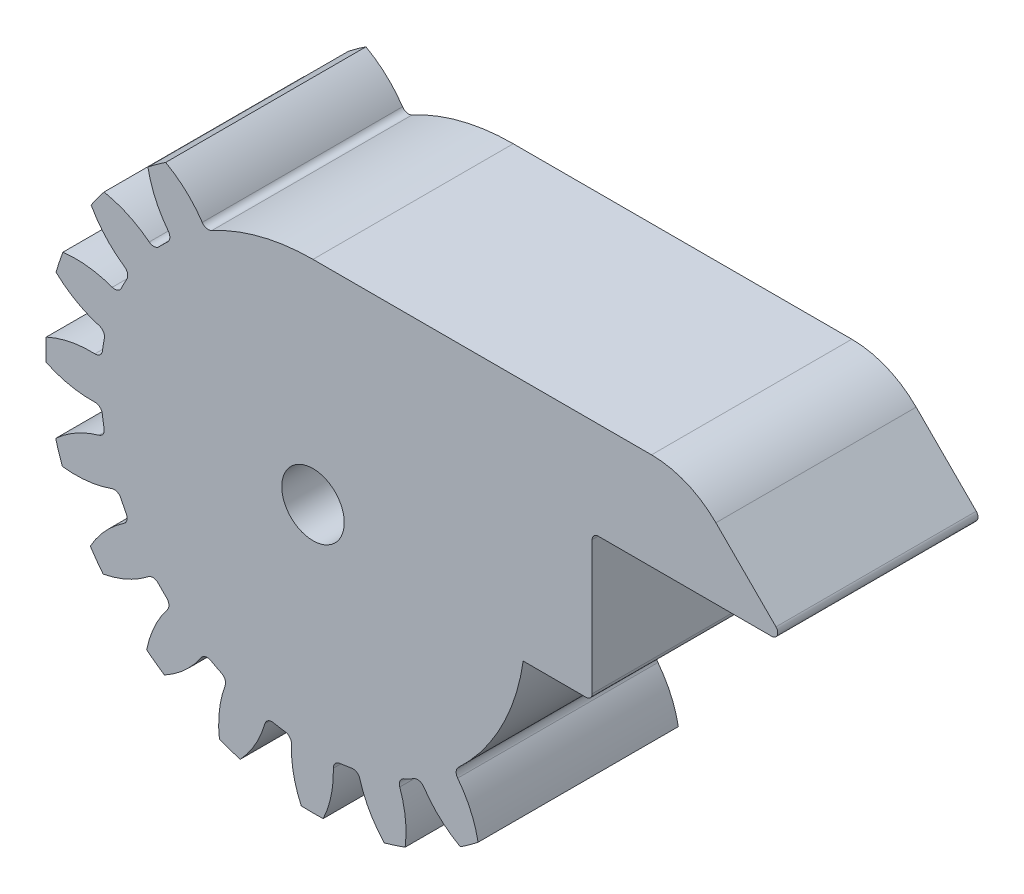
from build123d import *
from build123d.topology import SkipClean

# Parameters (mm, degrees)
SKBASE_R                                = 22
BASE_DEPTH                              = 8.25
TOOTHPROFILE_DEPTH                      = 33.187924754
FILLETTOOTHPROFILE_R                    = 0.6
CIRPATTERNTEETH_COUNT                   = 20
FILLETTOOTHPROFILE_OF_CIRPATTERNTEETH_R = 0.6
SKCHAVETA_R                             = 2.575
CHAVETA_DEPTH                           = 36.032658713
BODY_MOVE_COPY1_ANGLE                   = 8.84
CUT_EXTRUDE1_START                      = -16.5
CUT_EXTRUDE1_DEPTH                      = 16.5
BOSS_EXTRUDE1_START                     = -16.5
BOSS_EXTRUDE1_DEPTH                     = 16.5
SKETCH10_R                              = 5
SKETCH10_R_2                            = 2.575
BOSS_EXTRUDE2_DEPTH                     = 1.65
FILLET1_R                               = 0.5
FILLET2_R                               = 7.5


with BuildPart() as part:
    # skBase → Base (new, symmetric)
    with BuildSketch(Plane.XY):
        Circle(SKBASE_R)
    extrude(amount=BASE_DEPTH, both=True)

    # skToothProfile → ToothProfile (cut, symmetric)
    with BuildSketch(Plane.XY):
        with BuildLine():
            ThreePointArc((-1.056260379, 17.468094172), (-1.711312383, 20.303280592), (-3.25795804, 22.768085326))
            ThreePointArc((-3.25795804, 22.768085326), (0, 23), (3.25795804, 22.768085326))
            ThreePointArc((3.25795804, 22.768085326), (1.711312383, 20.303280592), (1.056260379, 17.468094172))
            ThreePointArc((1.056260379, 17.468094172), (0, 17.5), (-1.056260379, 17.468094172))
        make_face()
    toothprofile = extrude(amount=TOOTHPROFILE_DEPTH, both=True, mode=Mode.SUBTRACT)

    # FilletToothProfile
    fillettoothprofile_edges = [part.edges().sort_by_distance(p)[0] for p in [
        (1.056260379, 17.468094172, 0),
        (-1.056260379, 17.468094172, 0),
    ]]
    fillet(fillettoothprofile_edges, radius=FILLETTOOTHPROFILE_R)

    # CirPatternTeeth: ToothProfile ×20 about axis
    cirpatternteeth_axis = Axis((0, 0, 8.25), (0, 0, 1))
    for i in range(1, CIRPATTERNTEETH_COUNT):
        add(toothprofile.rotate(cirpatternteeth_axis, i * 360 / CIRPATTERNTEETH_COUNT), mode=Mode.SUBTRACT)

    # FilletToothProfile of CirPatternTeeth
    fillettoothprofile_of_cirpatternteeth_edges = [part.edges().sort_by_distance(p)[0] for p in [
        (-4.393374642, 16.939547198, 0),
        (-6.402501275, 16.286742382, 0),
        (-9.412955543, 14.752839318, 0),
        (-11.122020738, 13.511130771, 0),
        (-13.511130771, 11.122020738, 0),
        (-14.752839318, 9.412955543, 0),
        (-16.286742382, 6.402501275, 0),
        (-16.939547198, 4.393374642, 0),
        (-17.468094172, 1.056260379, 0),
        (-17.468094172, -1.056260379, 0),
        (-16.939547198, -4.393374642, 0),
        (-16.286742382, -6.402501275, 0),
        (-14.752839318, -9.412955543, 0),
        (-13.511130771, -11.122020738, 0),
        (-11.122020738, -13.511130771, 0),
        (-9.412955543, -14.752839318, 0),
        (-6.402501275, -16.286742382, 0),
        (-4.393374642, -16.939547198, 0),
        (-1.056260379, -17.468094172, 0),
        (1.056260379, -17.468094172, 0),
        (4.393374642, -16.939547198, 0),
        (6.402501275, -16.286742382, 0),
        (9.412955543, -14.752839318, 0),
        (11.122020738, -13.511130771, 0),
        (13.511130771, -11.122020738, 0),
        (14.752839318, -9.412955543, 0),
        (16.286742382, -6.402501275, 0),
        (16.939547198, -4.393374642, 0),
        (17.468094172, -1.056260379, 0),
        (17.468094172, 1.056260379, 0),
        (16.939547198, 4.393374642, 0),
        (16.286742382, 6.402501275, 0),
        (14.752839318, 9.412955543, 0),
        (13.511130771, 11.122020738, 0),
        (11.122020738, 13.511130771, 0),
        (9.412955543, 14.752839318, 0),
        (6.402501275, 16.286742382, 0),
        (4.393374642, 16.939547198, 0),
    ]]
    fillet(fillettoothprofile_of_cirpatternteeth_edges, radius=FILLETTOOTHPROFILE_OF_CIRPATTERNTEETH_R)

    # skChaveta → Chaveta (cut, through all)
    with BuildSketch(Plane.XY.offset(8.25)):
        Circle(SKCHAVETA_R)
    extrude(amount=-CHAVETA_DEPTH, mode=Mode.SUBTRACT)


with BuildPart() as part_1:
    # Body-Move/Copy1: moved
    add(part.part.rotate(Axis((0, 0, 0), (0, 0, 1)), BODY_MOVE_COPY1_ANGLE))

    # Sketch7 → Cut-Extrude1 (cut)
    with BuildSketch(Plane(origin=(0, 0, -8.25), x_dir=(-1, 0, 0), z_dir=(0, 0, -1)).offset(CUT_EXTRUDE1_START)):
        with BuildLine():
            ThreePointArc((3.177021559, 17.20919911), (5.361298987, 16.65852554), (7.456744124, 15.831833977))
            ThreePointArc((7.456744124, 15.831833977), (7.158104529, 16.144961281), (7.147753456, 16.577543263))
            ThreePointArc((7.147753456, 16.577543263), (7.612057292, 18.586093838), (7.594681004, 20.647537878))
            ThreePointArc((7.594681004, 20.647537878), (6.739918727, 20.942146393), (5.873773607, 21.201386361))
            ThreePointArc((5.873773607, 21.201386361), (4.657305951, 19.537036665), (3.862951402, 17.634708009))
            ThreePointArc((3.862951402, 17.634708009), (3.602236584, 17.289364557), (3.177021559, 17.20919911))
        make_face()
        with BuildLine():
            ThreePointArc((-2.296407928, 17.348674607), (-0.048869156, 17.499931766), (2.199479339, 17.361229526))
            ThreePointArc((2.199479339, 17.361229526), (1.818694547, 17.566746578), (1.675174908, 17.974957834))
            ThreePointArc((1.675174908, 17.974957834), (1.496077835, 20.028680723), (0.842530762, 21.983860942))
            ThreePointArc((0.842530762, 21.983860942), (-0.06143551, 21.99991422), (-0.965298025, 21.978812518))
            ThreePointArc((-0.965298025, 21.978812518), (-1.607915176, 20.020012717), (-1.775539362, 17.965321597))
            ThreePointArc((-1.775539362, 17.965321597), (-1.916776894, 17.556315147), (-2.296407928, 17.348674607))
        make_face()
        with BuildLine():
            ThreePointArc((-7.545049008, 15.789940958), (-5.454253645, 16.628322741), (-3.273085809, 17.191186966))
            ThreePointArc((-3.273085809, 17.191186966), (-3.698741928, 17.268976326), (-3.961381432, 17.612858293))
            ThreePointArc((-3.961381432, 17.612858293), (-4.766348144, 19.51072079), (-5.992092262, 21.168250526))
            ThreePointArc((-5.992092262, 21.168250526), (-6.856776011, 20.90417716), (-7.709879561, 20.604799372))
            ThreePointArc((-7.709879561, 20.604799372), (-7.715742363, 18.543290436), (-7.240227963, 16.537364335))
            ThreePointArc((-7.240227963, 16.537364335), (-7.248162894, 16.104731288), (-7.545049008, 15.789940958))
        make_face()
        with BuildLine():
            ThreePointArc((-12.055128121, 12.685577874), (-10.325737785, 14.12901763), (-8.425258513, 15.338351247))
            ThreePointArc((-8.425258513, 15.338351247), (-8.854119773, 15.280798351), (-9.210170156, 15.526689467))
            ThreePointArc((-9.210170156, 15.526689467), (-10.562210758, 17.082915568), (-12.240167545, 18.28054426))
            ThreePointArc((-12.240167545, 18.28054426), (-12.980927502, 17.762193592), (-13.699764368, 17.2138449))
            ThreePointArc((-13.699764368, 17.2138449), (-13.068298928, 15.251421688), (-11.996192606, 13.490614629))
            ThreePointArc((-11.996192606, 13.490614629), (-11.870048209, 13.076704123), (-12.055128121, 12.685577874))
        make_face()
        with BuildLine():
            ThreePointArc((-15.385167301, 8.339462041), (-14.186466768, 10.246665831), (-12.752708211, 11.98409084))
            ThreePointArc((-12.752708211, 11.98409084), (-13.142794684, 11.796829366), (-13.557403255, 11.920660095))
            ThreePointArc((-13.557403255, 11.920660095), (-15.324170592, 12.982915545), (-17.290089948, 13.603410955))
            ThreePointArc((-17.290089948, 13.603410955), (-17.834415365, 12.881522759), (-18.348620787, 12.137879354))
            ThreePointArc((-18.348620787, 12.137879354), (-17.141639343, 10.466637523), (-15.577886333, 9.123309569))
            ThreePointArc((-15.577886333, 9.123309569), (-15.330010503, 8.768638047), (-15.385167301, 8.339462041))
        make_face()
        with BuildLine():
            ThreePointArc((-13.490614629, -11.996192606), (-13.076704123, -11.870048209), (-12.685577874, -12.055128121))
            ThreePointArc((-12.685577874, -12.055128121), (-14.12901763, -10.325737785), (-15.338351247, -8.425258513))
            ThreePointArc((-15.338351247, -8.425258513), (-15.280798351, -8.854119773), (-15.526689467, -9.210170156))
            ThreePointArc((-15.526689467, -9.210170156), (-17.082915568, -10.562210758), (-18.28054426, -12.240167545))
            ThreePointArc((-18.28054426, -12.240167545), (-17.762193592, -12.980927502), (-17.2138449, -13.699764368))
            ThreePointArc((-17.2138449, -13.699764368), (-15.251421688, -13.068298928), (-13.490614629, -11.996192606))
        make_face()
        with BuildLine():
            ThreePointArc((-17.20919911, 3.177021559), (-16.65852554, 5.361298987), (-15.831833977, 7.456744124))
            ThreePointArc((-15.831833977, 7.456744124), (-16.144961281, 7.158104529), (-16.577543263, 7.147753456))
            ThreePointArc((-16.577543263, 7.147753456), (-18.586093838, 7.612057292), (-20.647537878, 7.594681004))
            ThreePointArc((-20.647537878, 7.594681004), (-20.942146393, 6.739918727), (-21.201386361, 5.873773607))
            ThreePointArc((-21.201386361, 5.873773607), (-19.537036665, 4.657305951), (-17.634708009, 3.862951402))
            ThreePointArc((-17.634708009, 3.862951402), (-17.289364557, 3.602236584), (-17.20919911, 3.177021559))
        make_face()
        with BuildLine():
            ThreePointArc((-16.537364335, -7.240227963), (-16.104731288, -7.248162894), (-15.789940958, -7.545049008))
            ThreePointArc((-15.789940958, -7.545049008), (-16.628322741, -5.454253645), (-17.191186966, -3.273085809))
            ThreePointArc((-17.191186966, -3.273085809), (-17.268976326, -3.698741928), (-17.612858293, -3.961381432))
            ThreePointArc((-17.612858293, -3.961381432), (-19.51072079, -4.766348144), (-21.168250526, -5.992092262))
            ThreePointArc((-21.168250526, -5.992092262), (-20.90417716, -6.856776011), (-20.604799372, -7.709879561))
            ThreePointArc((-20.604799372, -7.709879561), (-18.543290436, -7.715742363), (-16.537364335, -7.240227963))
        make_face()
        with BuildLine():
            ThreePointArc((-17.348674607, -2.296407928), (-17.499931766, -0.048869156), (-17.361229526, 2.199479339))
            ThreePointArc((-17.361229526, 2.199479339), (-17.566746578, 1.818694547), (-17.974957834, 1.675174908))
            ThreePointArc((-17.974957834, 1.675174908), (-20.028680723, 1.496077835), (-21.983860942, 0.842530762))
            ThreePointArc((-21.983860942, 0.842530762), (-21.99991422, -0.06143551), (-21.978812518, -0.965298025))
            ThreePointArc((-21.978812518, -0.965298025), (-20.020012717, -1.607915176), (-17.965321597, -1.775539362))
            ThreePointArc((-17.965321597, -1.775539362), (-17.556315147, -1.916776894), (-17.348674607, -2.296407928))
        make_face()
    extrude(amount=CUT_EXTRUDE1_DEPTH, mode=Mode.SUBTRACT)

    # Sketch9 → Boss-Extrude1 (add)
    with BuildSketch(Plane(origin=(0, 0, -8.25), x_dir=(-1, 0, 0), z_dir=(0, 0, -1)).offset(BOSS_EXTRUDE1_START)):
        with BuildLine():
            ThreePointArc((-17.320508076, -2.5), (-13.228756555, 11.456439237), (0, 17.5))
            Line((0, 17.5), (-31, 17.5))
            Line((-31, 17.5), (-39, 9.5))
            Line((-39, 9.5), (-23, 9.5))
            Line((-23, 9.5), (-23, -2.5))
            Line((-23, -2.5), (-17.320508076, -2.5))
        make_face()
    extrude(amount=BOSS_EXTRUDE1_DEPTH)

    # Sketch10 → Boss-Extrude2 (add)
    with SkipClean():  # the faces are left unmerged after this step: merging them gives an invalid solid
        with BuildSketch(Plane(origin=(0, 0, -8.25), x_dir=(-1, 0, 0), z_dir=(0, 0, -1))):
            Circle(SKETCH10_R)
            Circle(SKETCH10_R_2, mode=Mode.SUBTRACT)
        extrude(amount=BOSS_EXTRUDE2_DEPTH)
    add(part_1.part.scale(1), mode=Mode.REPLACE)  # the faces are merged on a copy

    # Fillet1
    fillet1_edges = [part_1.edges().sort_by_distance(p)[0] for p in [
        (23, -2.5, 0),
        (23, 9.5, 0),
        (39, 9.5, 0),
    ]]
    fillet(fillet1_edges, radius=FILLET1_R)

    # Fillet2
    fillet2_edges = [part_1.edges().sort_by_distance(p)[0] for p in [
        (31, 17.5, 0),
    ]]
    fillet(fillet2_edges, radius=FILLET2_R)


solid = part_1.part
